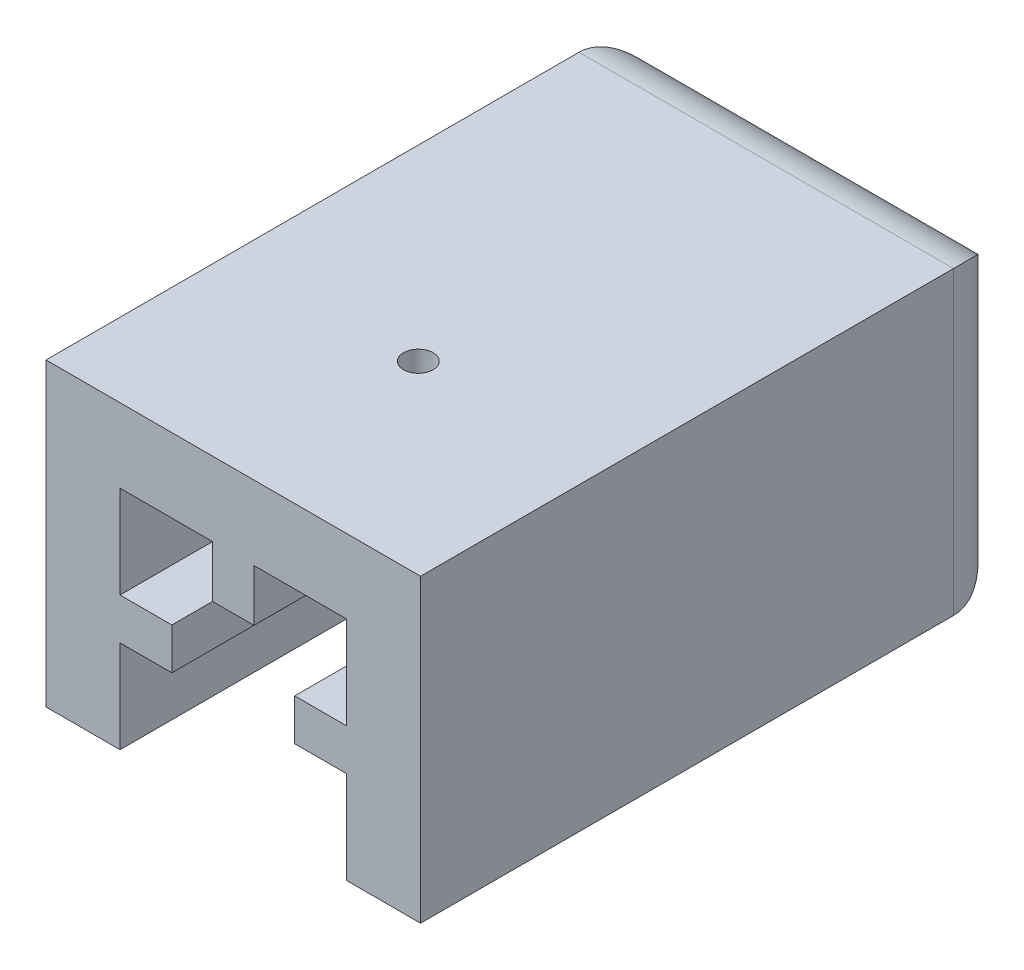
from build123d import *

# Parameters (mm, degrees)
RESSALTO_EXTRUS_O1_DEPTH   = 20
ESBO_O2_W                  = 25.3
ESBO_O2_H                  = 20.3
ESBO_O2_R                  = 3.85
RESSALTO_EXTRUS_O2_DEPTH   = 20
CORTE_EXTRUS_O1_DEPTH      = 10
ESBO_O3_W                  = 3.5
ESBO_O3_H                  = 2.8
ESBO_O3_W_2                = 2.8
ESBO_O3_H_2                = 3.5
RESSALTO_EXTRUS_O3_DEPTH   = 17
CORTE_EXTRUS_O2_DEPTH      = 29.180001774
CORTE_EXTRUS_O2_DEPTH_BACK = 29.180001774
ESBO_O4_R                  = 1
FILETE1_R                  = 4


with BuildPart() as part:
    # Esboço1 → Ressalto-extrusão1 (new body)
    with BuildSketch(Plane.XY):
        Polygon((-7.65, 0), (-12.65, 0), (-12.65, 20.3), (12.65, 20.3), (12.65, 0), (7.65, 0), (7.65, 15.3), (-7.65, 15.3), align=None)
    extrude(amount=RESSALTO_EXTRUS_O1_DEPTH)

    # Esboço2 → Ressalto-extrusão2 (add)
    with BuildSketch(Plane(origin=(0, 0, 0), x_dir=(-1, 0, 0), z_dir=(0, 0, -1))):
        with Locations((0, 10.15)):
            Rectangle(ESBO_O2_W, ESBO_O2_H)
        with Locations((0, 7.65)):
            Circle(ESBO_O2_R, mode=Mode.SUBTRACT)
    extrude(amount=RESSALTO_EXTRUS_O2_DEPTH)

    # Esboço2<3> → Corte-extrusão1 (cut)
    with BuildSketch(Plane(origin=(0, 0, 0), x_dir=(-1, 0, 0), z_dir=(0, 0, -1))):
        with BuildLine():
            Line((3.85, 3.8), (2.722361108, 4.927638892))
            ThreePointArc((2.722361108, 4.927638892), (-1.473331215, 4.0930638), (-3.85, 7.65))
            Line((-3.85, 7.65), (-3.85, 0))
            Line((-3.85, 0), (3.85, 0))
            Line((3.85, 0), (3.85, 3.8))
        make_face()
        with BuildLine():
            ThreePointArc((3.85, 7.65), (3.5569362, 6.176668785), (2.722361108, 4.927638892))
            Line((2.722361108, 4.927638892), (3.85, 3.8))
            Line((3.85, 3.8), (3.85, 7.65))
        make_face()
    extrude(amount=CORTE_EXTRUS_O1_DEPTH, mode=Mode.SUBTRACT)

    # Esboço3 → Ressalto-extrusão3 (add)
    with BuildSketch(Plane.XY.offset(20)):
        with Locations((5.9, 7.65)):
            Rectangle(ESBO_O3_W, ESBO_O3_H)
        with Locations((-5.9, 7.65)):
            Rectangle(ESBO_O3_W, ESBO_O3_H)
        with Locations((0, 13.55)):
            Rectangle(ESBO_O3_W_2, ESBO_O3_H_2)
    extrude(amount=-RESSALTO_EXTRUS_O3_DEPTH)

    # Esboço4 → Corte-extrusão2 (cut, two sides: drawn at the far end of the back side and taken through both)
    with BuildSketch(Plane.XZ.offset(-15.3).offset(-CORTE_EXTRUS_O2_DEPTH_BACK)):
        with Locations(Location((0, 7.5, 0), (0, 0, 270))):
            Circle(ESBO_O4_R)
    extrude(amount=CORTE_EXTRUS_O2_DEPTH + CORTE_EXTRUS_O2_DEPTH_BACK, mode=Mode.SUBTRACT)

    # Filete1
    # the kernel refuses this fillet: 4 mm, written as the material it takes off along each edge
    with BuildSketch(Plane(origin=(12.65, -10, -20), x_dir=(-1, 0, 0), z_dir=(0, 1, 0))) as filete1_piece_1:
        with BuildLine():
            CenterArc((FILETE1_R, FILETE1_R), FILETE1_R, 180, 90)
            Line((0, FILETE1_R), (0, 0))
            Line((0, 0), (FILETE1_R, 0))
        make_face()
    extrude(amount=40.3, mode=Mode.SUBTRACT)
    with BuildSketch(Plane(origin=(-22.65, 0, -20), x_dir=(0, 0, 1), z_dir=(1, 0, 0)), Plane(origin=(22.65, 20.3, -20), x_dir=(0, 0, 1), z_dir=(-1, 0, 0))) as filete1_piece_2:
        with BuildLine():
            CenterArc((FILETE1_R, -FILETE1_R), FILETE1_R, 90, 90)
            Line((0, -FILETE1_R), (0, 0))
            Line((0, 0), (FILETE1_R, 0))
        make_face()
    extrude(amount=45.3, mode=Mode.SUBTRACT)
    with BuildSketch(Plane(origin=(-12.65, 30.3, -20), x_dir=(0, 0, 1), z_dir=(0, -1, 0))) as filete1_piece_3:
        with BuildLine():
            CenterArc((FILETE1_R, -FILETE1_R), FILETE1_R, 90, 90)
            Line((0, -FILETE1_R), (0, 0))
            Line((0, 0), (FILETE1_R, 0))
        make_face()
    extrude(amount=40.3, mode=Mode.SUBTRACT)


solid = part.part
